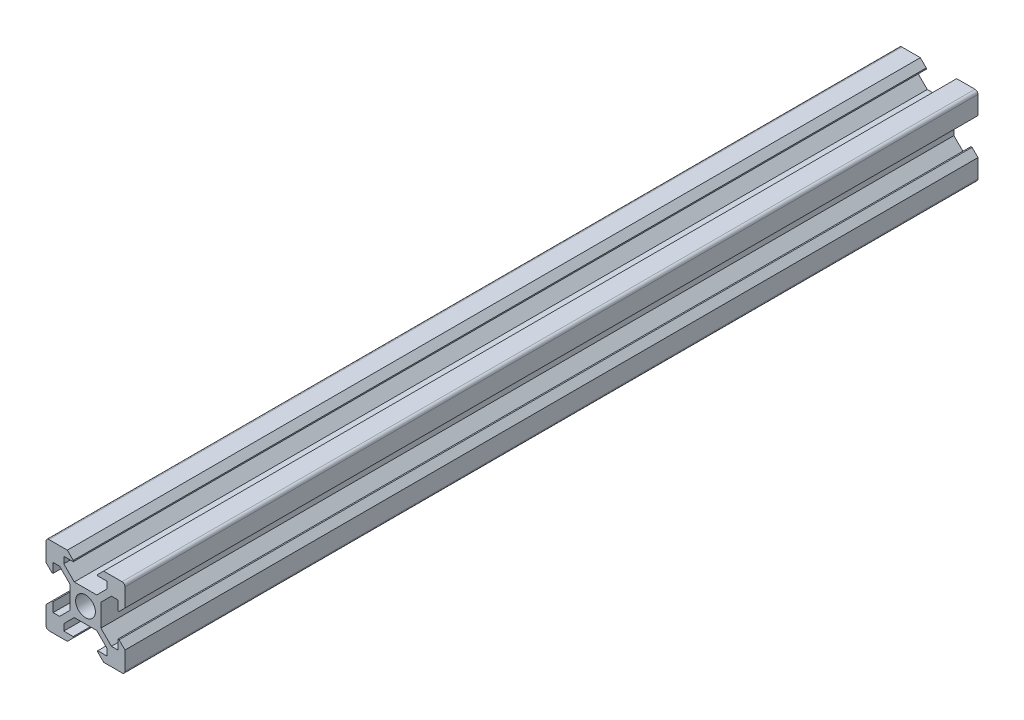
from build123d import *

# Parameters (mm, degrees)
CROQUIS1_R              = 2.5
SALIENTE_EXTRUIR1_DEPTH = 215.95


with BuildPart() as part:
    # Croquis1 → Saliente-Extruir1 (new body)
    with BuildSketch(Plane.XY):
        with BuildLine():
            Line((-4.6, 10), (-3.1, 8.5))
            Line((-3.1, 8.5), (-3.1, 8.2))
            Line((-3.1, 8.2), (-5.5, 8.2))
            Line((-5.5, 8.2), (-5.5, 6.560660172))
            Line((-5.5, 6.560660172), (-2.84, 3.900660172))
            Line((-2.84, 3.900660172), (0, 3.900660172))
            Line((0, 3.900660172), (2.84, 3.900660172))
            Line((2.84, 3.900660172), (5.5, 6.560660172))
            Line((5.5, 6.560660172), (5.5, 8.2))
            Line((5.5, 8.2), (3.1, 8.2))
            Line((3.1, 8.2), (3.1, 8.5))
            Line((3.1, 8.5), (4.6, 10))
            Line((4.6, 10), (9.25, 10))
            ThreePointArc((9.25, 10), (9.780330086, 9.780330086), (10, 9.25))
            Line((10, 9.25), (10, 4.6))
            Line((10, 4.6), (8.5, 3.1))
            Line((8.5, 3.1), (8.2, 3.1))
            Line((8.2, 3.1), (8.2, 5.5))
            Line((8.2, 5.5), (6.560660172, 5.5))
            Line((6.560660172, 5.5), (3.900660172, 2.84))
            Line((3.900660172, 2.84), (3.900660172, 0))
            Line((3.900660172, 0), (3.900660172, -2.84))
            Line((3.900660172, -2.84), (6.560660172, -5.5))
            Line((6.560660172, -5.5), (8.2, -5.5))
            Line((8.2, -5.5), (8.2, -3.1))
            Line((8.2, -3.1), (8.5, -3.1))
            Line((8.5, -3.1), (10, -4.6))
            Line((10, -4.6), (10, -9.25))
            ThreePointArc((10, -9.25), (9.780330086, -9.780330086), (9.25, -10))
            Line((9.25, -10), (4.6, -10))
            Line((4.6, -10), (3.1, -8.5))
            Line((3.1, -8.5), (3.1, -8.2))
            Line((3.1, -8.2), (5.5, -8.2))
            Line((5.5, -8.2), (5.5, -6.560660172))
            Line((5.5, -6.560660172), (2.84, -3.900660172))
            Line((2.84, -3.900660172), (0, -3.900660172))
            Line((0, -3.900660172), (-2.84, -3.900660172))
            Line((-2.84, -3.900660172), (-5.5, -6.560660172))
            Line((-5.5, -6.560660172), (-5.5, -8.2))
            Line((-5.5, -8.2), (-3.1, -8.2))
            Line((-3.1, -8.2), (-3.1, -8.5))
            Line((-3.1, -8.5), (-4.6, -10))
            Line((-4.6, -10), (-9.25, -10))
            ThreePointArc((-9.25, -10), (-9.780330086, -9.780330086), (-10, -9.25))
            Line((-10, -9.25), (-10, -4.6))
            Line((-10, -4.6), (-8.5, -3.1))
            Line((-8.5, -3.1), (-8.2, -3.1))
            Line((-8.2, -3.1), (-8.2, -5.5))
            Line((-8.2, -5.5), (-6.560660172, -5.5))
            Line((-6.560660172, -5.5), (-3.900660172, -2.84))
            Line((-3.900660172, -2.84), (-3.900660172, 0))
            Line((-3.900660172, 0), (-3.900660172, 2.84))
            Line((-3.900660172, 2.84), (-6.560660172, 5.5))
            Line((-6.560660172, 5.5), (-8.2, 5.5))
            Line((-8.2, 5.5), (-8.2, 3.1))
            Line((-8.2, 3.1), (-8.5, 3.1))
            Line((-8.5, 3.1), (-10, 4.6))
            Line((-10, 4.6), (-10, 9.25))
            ThreePointArc((-10, 9.25), (-9.780330086, 9.780330086), (-9.25, 10))
            Line((-9.25, 10), (-4.6, 10))
        make_face()
        Circle(CROQUIS1_R, mode=Mode.SUBTRACT)
    extrude(amount=SALIENTE_EXTRUIR1_DEPTH)


solid = part.part
